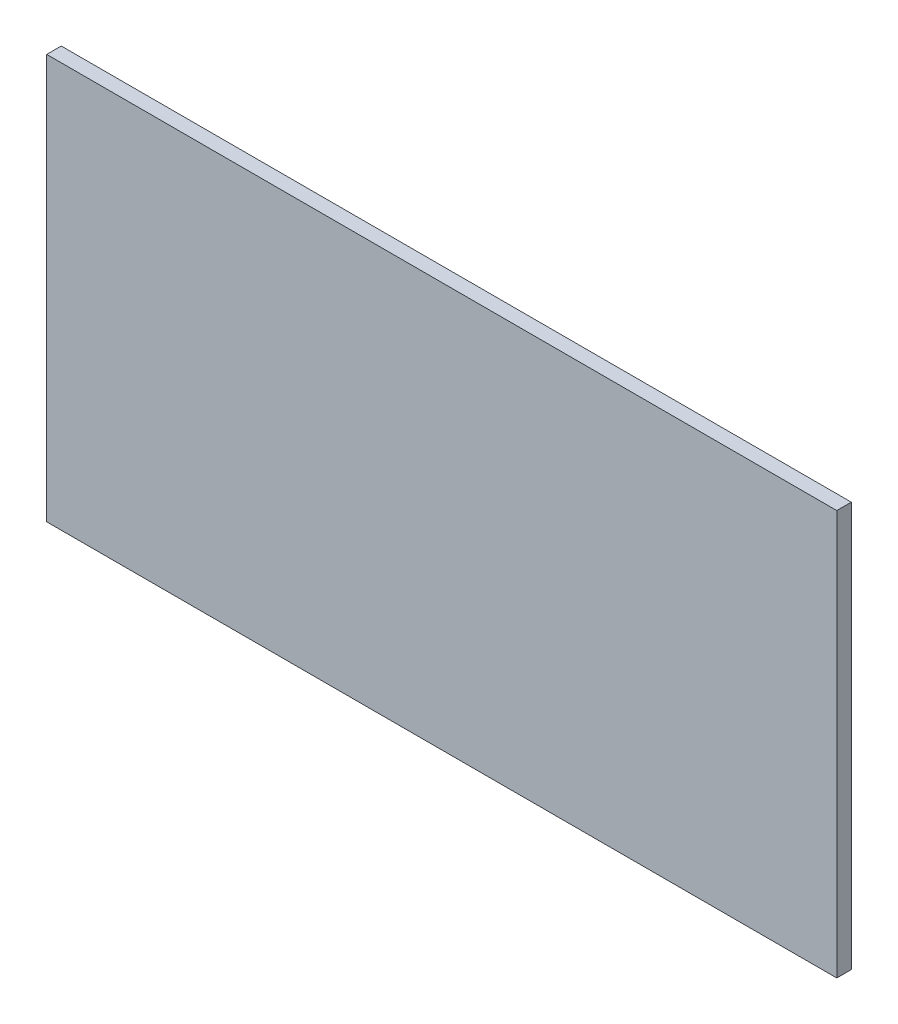
from build123d import *

# Parameters (mm, degrees)
SKETCH1_W           = 163.178820173
SKETCH1_H           = 83.61431582
BOSS_EXTRUDE1_DEPTH = 3


with BuildPart() as part:
    # Sketch1 → Boss-Extrude1 (new body)
    with BuildSketch(Plane.XY):
        with Locations((-102.048100406, 5.79284209)):
            Rectangle(SKETCH1_W, SKETCH1_H)
    extrude(amount=BOSS_EXTRUDE1_DEPTH)


solid = part.part
